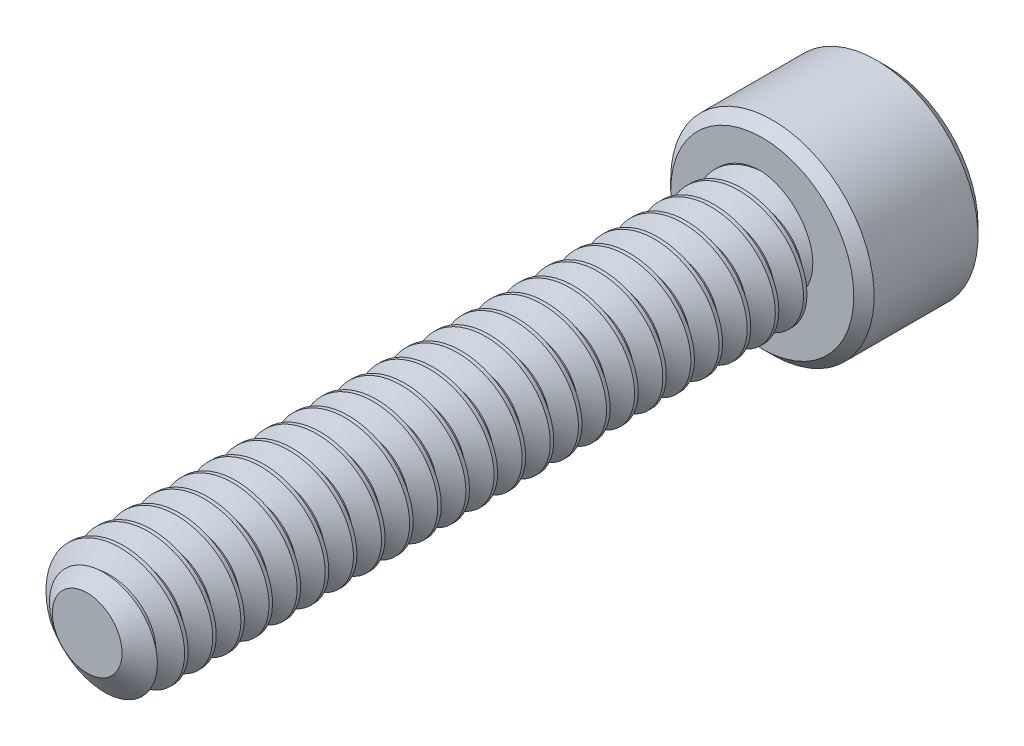
from build123d import *

# Parameters (mm, degrees)
SKETCH1_R          = 1.7526
EXTRUDE1_DEPTH     = 19.05
CUT_SWEEP1_PITCH   = 0.79375
SKETCH6_R          = 2.8702
EXTRUDE2_DEPTH     = 3.5052
CUT_EXTRUDE1_DEPTH = 2.08359375
CHAMFER1_SIZE      = 0.28702


with BuildPart() as part:
    # Sketch1 → Extrude1 (new body)
    with BuildSketch(Plane.XY):
        Circle(SKETCH1_R)
    extrude(amount=-EXTRUDE1_DEPTH)

    # Cut-Sweep1: the profile of Sketch3 profile screwed along a right-hand helix of 25 turns, 6 arcs to a turn; built about Z, then put on its axis
    cut_sweep1_z = Axis((0, 0, 0), (0, 0, 1))
    cut_sweep1_corners = [(1.7529, 0, -0.694704455), (1.237044252, 0, -0.396875), (1.237044252, 0, -0.29765625), (1.7529, 0, 0.000173205)]
    with BuildLine(mode=Mode.PRIVATE) as cut_sweep1_profile:
        Line(cut_sweep1_corners[0], cut_sweep1_corners[1])
        Line(cut_sweep1_corners[1], cut_sweep1_corners[2])
        Line(cut_sweep1_corners[2], cut_sweep1_corners[3])
        Line(cut_sweep1_corners[3], cut_sweep1_corners[0])
    cut_sweep1_cap = Face(cut_sweep1_profile.wire())
    cut_sweep1_turn_angles = [0, 30, 60, 90, 120, 150, 180, 210, 240, 270, 300, 330, 360]
    cut_sweep1_turn_weights = [1, 0.8660254037844387, 1, 0.8660254037844387, 1, 0.8660254037844387, 1, 0.8660254037844387, 1, 0.8660254037844387, 1, 0.8660254037844387, 1]
    cut_sweep1_turn_rails = [Edge.make_bspline([Vector(p[0], p[1], 0).rotate(cut_sweep1_z, cut_sweep1_turn_angles[k]) / cut_sweep1_turn_weights[k] + Vector(0, 0, p[2] + CUT_SWEEP1_PITCH * cut_sweep1_turn_angles[k] / 360) for k in range(13)], [0, 0, 0, 1, 1, 2, 2, 3, 3, 4, 4, 5, 5, 6, 6, 6], 2, cut_sweep1_turn_weights) for p in cut_sweep1_corners]
    cut_sweep1_turn_sides = [Face.make_surface_from_curves(cut_sweep1_turn_rails[p[0]], cut_sweep1_turn_rails[p[1]]) for p in [(0, 1), (1, 2), (2, 3), (3, 0)]]
    cut_sweep1 = Plane(origin=(0, 0, 0), x_dir=(0, 1, 0), z_dir=(0, 0, -1)) * Solid(Shell([*[p.moved(Location((0, 0, CUT_SWEEP1_PITCH * i))) for i in range(25) for p in cut_sweep1_turn_sides], cut_sweep1_cap, cut_sweep1_cap.rotate(cut_sweep1_z, 9000).moved(Location((0, 0, CUT_SWEEP1_PITCH * 9000 / 360)))]))
    add(cut_sweep1, mode=Mode.SUBTRACT)

    # Sketch4 → Cut-Revolve1 (revolve, cut)
    with BuildSketch(Plane(origin=(0, 0, 0), x_dir=(0, 0, -1), z_dir=(1, 0, 0)), mode=Mode.PRIVATE) as cut_revolve1_sk:
        Polygon((0.538848736, 1.7526), (0, 0.983044252), (0, 1.7526), align=None)
    revolve(cut_revolve1_sk.sketch.rotate(Axis((0, 0, 0), (0, 0, -1)), 261.048315518), axis=Axis((0, 0, 0), (0, 0, -1)), mode=Mode.SUBTRACT)

    # Sketch6 → Extrude2 (add)
    with BuildSketch(Plane(origin=(0, 0, -19.05), x_dir=(-1, 0, 0), z_dir=(0, 0, -1))):
        Circle(SKETCH6_R)
    extrude(amount=EXTRUDE2_DEPTH)

    # Sketch7 → Cut-Extrude1 (cut)
    with BuildSketch(Plane(origin=(0, 0, -22.5552), x_dir=(-1, 0, 0), z_dir=(0, 0, -1))):
        Polygon((0, 1.603951217), (-1.3890625, 0.801975608), (-1.3890625, -0.801975608), (0, -1.603951217), (1.3890625, -0.801975608), (1.3890625, 0.801975608), align=None)
    extrude(amount=-CUT_EXTRUDE1_DEPTH, mode=Mode.SUBTRACT)

    # Cut-Extrude2 cone 1 section (through the dimple's axis) → Cut-Extrude2 (revolve, cut)
    with BuildSketch(Plane(origin=(0, 0, -22.5552), x_dir=(0, 1, 0), z_dir=(1, 0, 0))):
        Polygon((0, 0), (1.603951217, 0), (0, 1.603951217), align=None)
    revolve(axis=Axis((0, 0, -22.5552), (0, 0, 1)), mode=Mode.SUBTRACT)

    # Chamfer1
    chamfer1_edges = [part.edges().sort_by_distance(p)[0] for p in [
        (2.8702, 0, -19.05),
        (2.8702, 0, -22.5552),
    ]]
    chamfer(chamfer1_edges, length=CHAMFER1_SIZE)


solid = part.part
